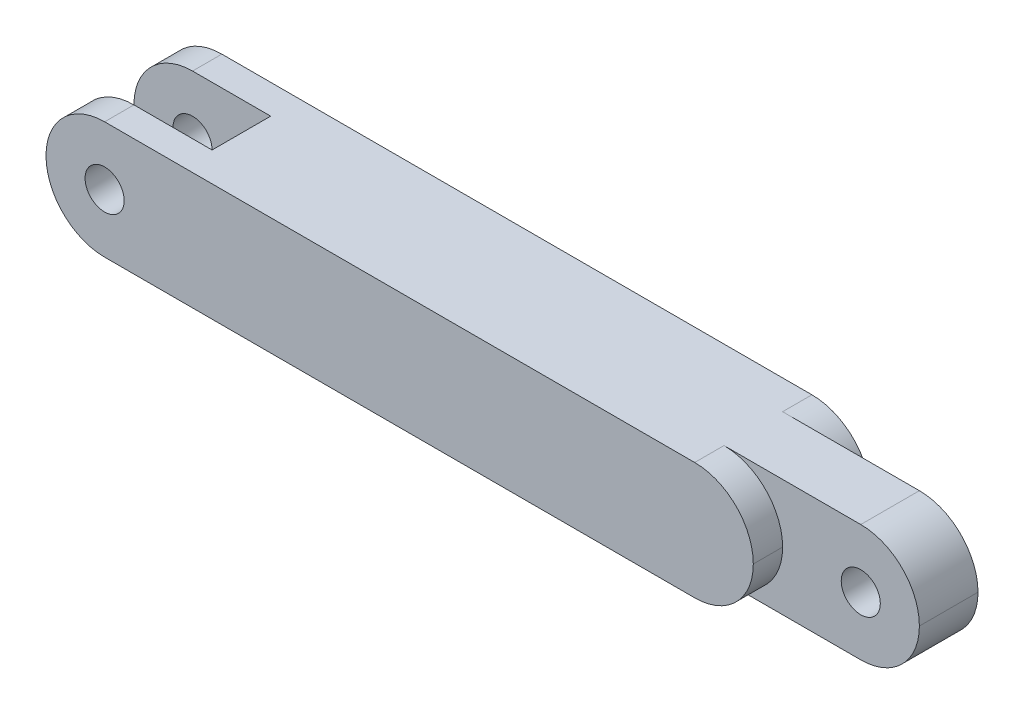
from build123d import *

# Parameters (mm, degrees)
SKETCH1_W               = 216
SKETCH1_H               = 30
BOSS_EXTRUDE1_DEPTH     = 15
CUT_EXTRUDE1_REACH      = 220.589
SKETCH2_W               = 35
SKETCH2_H               = 15
SKETCH2_H_2             = 7.5
FILLET1_R               = 15
CUT_EXTRUDE2_DEPTH      = 221.127235934
CUT_EXTRUDE2_DEPTH_BACK = 221.127235934
SKETCH3_R               = 5
FILLET3_R               = 15


with BuildPart() as part:
    # Sketch1 → Boss-Extrude1 (new, symmetric)
    with BuildSketch(Plane.XY):
        with Locations((108, 15)):
            Rectangle(SKETCH1_W, SKETCH1_H)
    extrude(amount=BOSS_EXTRUDE1_DEPTH, both=True)

    # Sketch2 → Cut-Extrude1 (cut, up to next)
    with BuildSketch(Plane(origin=(0, 30, 0), x_dir=(1, 0, 0), z_dir=(0, 1, 0)), mode=Mode.PRIVATE) as cut_extrude1_sk1:
        with Locations((17.5, 0)):
            Rectangle(SKETCH2_W, SKETCH2_H)
    cut_extrude1_tool1 = extrude(cut_extrude1_sk1.sketch, amount=-CUT_EXTRUDE1_REACH, mode=Mode.PRIVATE) & part.part
    # Sketch2 → Cut-Extrude1 (cut, up to next)
    with BuildSketch(Plane(origin=(0, 30, 0), x_dir=(1, 0, 0), z_dir=(0, 1, 0)), mode=Mode.PRIVATE) as cut_extrude1_sk2:
        with Locations((198.5, 11.25)):
            Rectangle(SKETCH2_W, SKETCH2_H_2)
    cut_extrude1_tool2 = extrude(cut_extrude1_sk2.sketch, amount=-CUT_EXTRUDE1_REACH, mode=Mode.PRIVATE) & part.part
    # Sketch2 → Cut-Extrude1 (cut, up to next)
    with BuildSketch(Plane(origin=(0, 30, 0), x_dir=(1, 0, 0), z_dir=(0, 1, 0)), mode=Mode.PRIVATE) as cut_extrude1_sk3:
        with Locations((198.5, -11.25)):
            Rectangle(SKETCH2_W, SKETCH2_H_2)
    cut_extrude1_tool3 = extrude(cut_extrude1_sk3.sketch, amount=-CUT_EXTRUDE1_REACH, mode=Mode.PRIVATE) & part.part
    add(cut_extrude1_tool1.solids().sort_by_distance((17.5, 30, 0))[0], mode=Mode.SUBTRACT)
    add(cut_extrude1_tool2.solids().sort_by_distance((198.5, 30, -11.25))[0], mode=Mode.SUBTRACT)
    add(cut_extrude1_tool3.solids().sort_by_distance((198.5, 30, 11.25))[0], mode=Mode.SUBTRACT)

    # Fillet1
    fillet1_edges = [part.edges().sort_by_distance(p)[0] for p in [
        (216, 0, 0),
        (216, 30, 0),
        (0, 0, 11.25),
        (0, 0, -11.25),
        (0, 30, -11.25),
        (0, 30, 11.25),
    ]]
    fillet(fillet1_edges, radius=FILLET1_R - 0.0001)  # a hair under: the kernel refuses the full size

    # Sketch3 → Cut-Extrude2 (cut, two sides: drawn at the far end of the back side and taken through both)
    with BuildSketch(Plane.XY.offset(15).offset(-CUT_EXTRUDE2_DEPTH_BACK)):
        with Locations((15, 15)):
            Circle(SKETCH3_R)
        with Locations((201, 15)):
            Circle(SKETCH3_R)
    extrude(amount=CUT_EXTRUDE2_DEPTH + CUT_EXTRUDE2_DEPTH_BACK, mode=Mode.SUBTRACT)

    # Fillet3
    fillet3_edges = [part.edges().sort_by_distance(p)[0] for p in [
        (181, 0, -11.25),
        (181, 30, -11.25),
        (181, 0, 11.25),
        (181, 30, 11.25),
    ]]
    fillet(fillet3_edges, radius=FILLET3_R - 0.0001)  # a hair under: the kernel refuses the full size


solid = part.part
